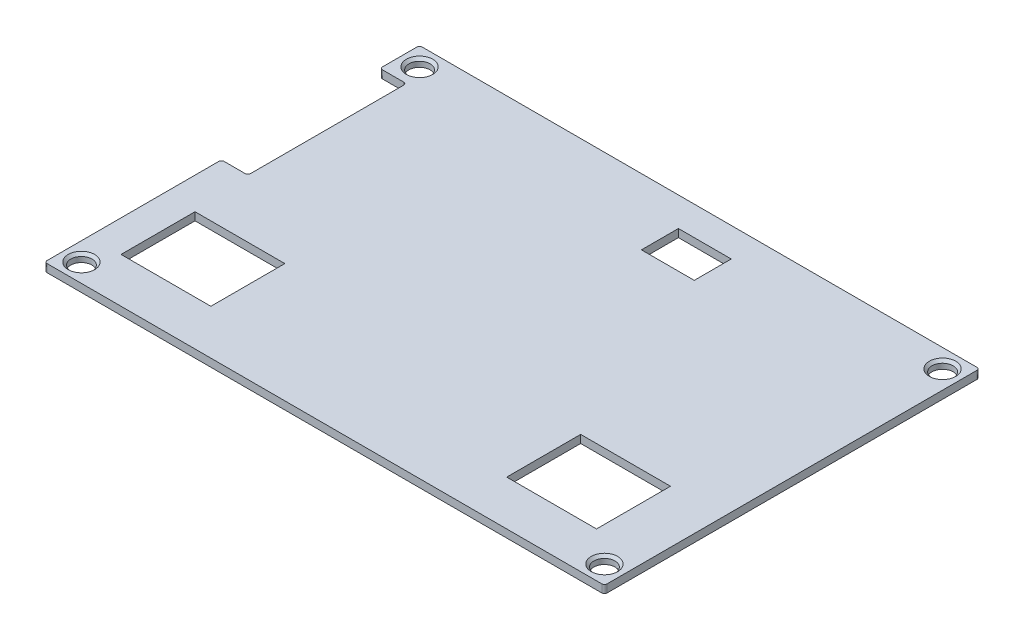
from build123d import *

# Parameters (mm, degrees)
SKETCH2_W           = 106
SKETCH2_H           = 71
SKETCH2_W_2         = 17
SKETCH2_H_2         = 14
SKETCH2_W_3         = 10
SKETCH2_H_3         = 7
BOSS_EXTRUDE1_DEPTH = 1.5
SKETCH3_R           = 2
CUT_EXTRUDE1_DEPTH  = 1.5
CHAMFER2_SIZE       = 0.5
SKETCH4_W           = 5
SKETCH4_H           = 30
CUT_EXTRUDE2_DEPTH  = 1.5
FILLET1_R           = 0.5


# Read off the part's stored shape, not the designer's step: Mirror1
with BuildPart() as part:
    # Sketch2 → Boss-Extrude1 (new body)
    with BuildSketch(Plane(origin=(0, 0, 0), x_dir=(1, 0, 0), z_dir=(0, 1, 0))):
        Rectangle(SKETCH2_W, SKETCH2_H)
        with Locations((34.5, -20)):
            Rectangle(SKETCH2_W_2, SKETCH2_H_2, mode=Mode.SUBTRACT)
        with Locations((-38.5, -20)):
            Rectangle(SKETCH2_W_2, SKETCH2_H_2, mode=Mode.SUBTRACT)
        with Locations((6.5, 26.5)):
            Rectangle(SKETCH2_W_3, SKETCH2_H_3, mode=Mode.SUBTRACT)
    extrude(amount=BOSS_EXTRUDE1_DEPTH)

    # Sketch3 → Cut-Extrude1 (cut)
    with BuildSketch(Plane(origin=(0, 1.5, 0), x_dir=(1, 0, 0), z_dir=(0, 1, 0))):
        with Locations(Location((49.5, 32, 0), (0, 0, 270))):
            Circle(SKETCH3_R)
    extrude(amount=-CUT_EXTRUDE1_DEPTH, mode=Mode.SUBTRACT)

    # Chamfer2
    chamfer2_edges = [part.edges().sort_by_distance(p)[0] for p in [
        (49.5, 1.5, -34),
    ]]
    chamfer(chamfer2_edges, length=CHAMFER2_SIZE)

    # Mirror1 outline → Mirror1 (revolve, cut)
    with BuildSketch(Plane(origin=(-49.5, 0, 32), x_dir=(1, 0, 0), z_dir=(0, 0, 1))):
        Polygon((0, 0), (2, 0), (2, 1), (2.5, 1.5), (0, 1.5), align=None)
    revolve(axis=Axis((-49.5, 0, 32), (0, 1, 0)), mode=Mode.SUBTRACT)

    # Mirror1 2 outline → Mirror1 2 (revolve, cut)
    with BuildSketch(Plane(origin=(49.5, 0, 32), x_dir=(1, 0, 0), z_dir=(0, 0, 1))):
        Polygon((0, 0), (2, 0), (2, 1), (2.5, 1.5), (0, 1.5), align=None)
    revolve(axis=Axis((49.5, 0, 32), (0, 1, 0)), mode=Mode.SUBTRACT)

    # Mirror1 3 outline → Mirror1 3 (revolve, cut)
    with BuildSketch(Plane(origin=(-49.5, 0, -32), x_dir=(1, 0, 0), z_dir=(0, 0, 1))):
        Polygon((0, 0), (2, 0), (2, 1), (2.5, 1.5), (0, 1.5), align=None)
    revolve(axis=Axis((-49.5, 0, -32), (0, 1, 0)), mode=Mode.SUBTRACT)

    # Sketch4 → Cut-Extrude2 (cut)
    with BuildSketch(Plane(origin=(0, 1.5, 0), x_dir=(1, 0, 0), z_dir=(0, 1, 0))):
        with Locations((-50.5, 13)):
            Rectangle(SKETCH4_W, SKETCH4_H)
    extrude(amount=-CUT_EXTRUDE2_DEPTH, mode=Mode.SUBTRACT)

    # Fillet1
    fillet1_edges = [part.edges().sort_by_distance(p)[0] for p in [
        (53, 0.75, 35.5),
        (-53, 0.75, 35.5),
        (-53, 0.75, -35.5),
        (53, 0.75, -35.5),
        (-53, 0.75, 2),
        (-53, 0.75, -28),
        (-48, 0.75, -28),
        (-48, 0.75, 2),
    ]]
    fillet(fillet1_edges, radius=FILLET1_R)


solid = part.part
